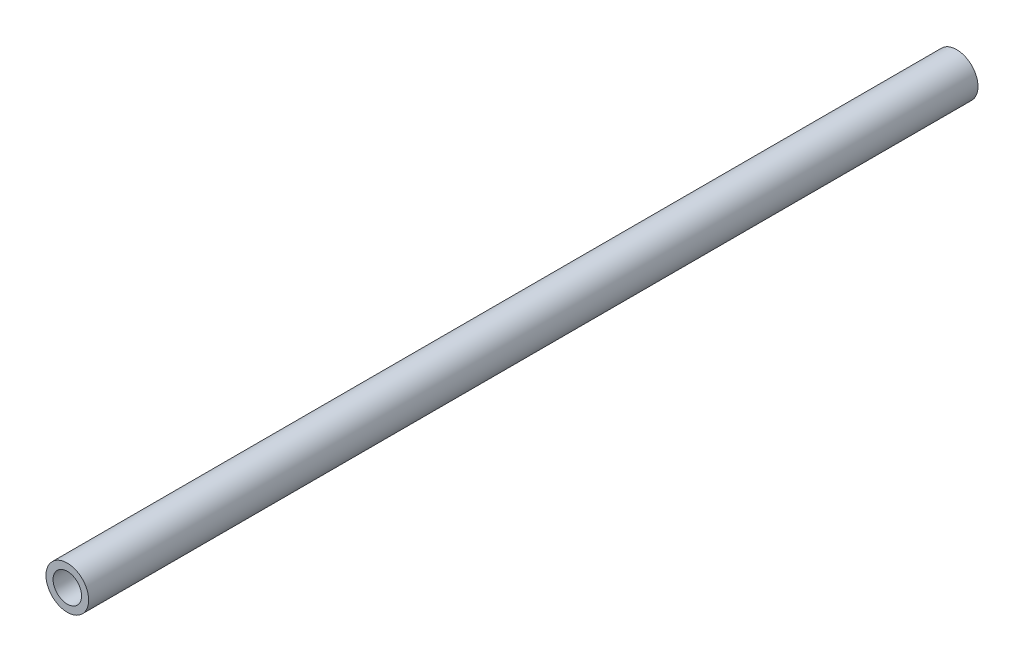
from build123d import *

# Parameters (mm, degrees)
ESQUISSE1_R        = 3
ESQUISSE1_R_2      = 2
BOSS_EXTRU_1_DEPTH = 125


with BuildPart() as part:
    # Esquisse1 → Boss.-Extru.1 (new body)
    with BuildSketch(Plane.XY):
        Circle(ESQUISSE1_R)
        Circle(ESQUISSE1_R_2, mode=Mode.SUBTRACT)
    extrude(amount=BOSS_EXTRU_1_DEPTH)


solid = part.part
